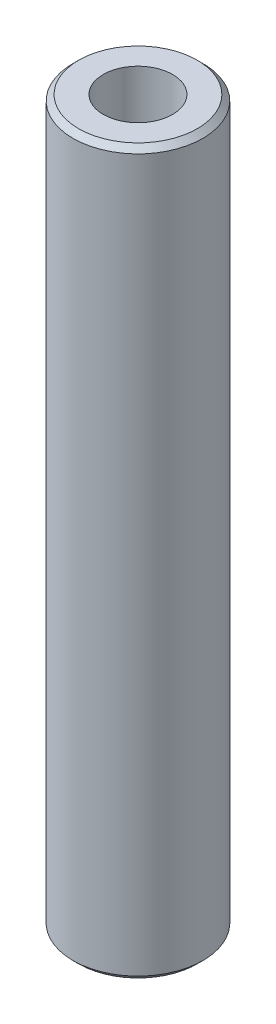
from build123d import *

# Parameters (mm, degrees)
SKETCH1_R           = 42.5
BOSS_EXTRUDE1_DEPTH = 473.387259306
SKETCH2_R           = 22.683361614
CUT_EXTRUDE1_DEPTH  = 478.187591281
CHAMFER1_SIZE       = 3.658712747


with BuildPart() as part:
    # Sketch1 → Boss-Extrude1 (new body)
    with BuildSketch(Plane(origin=(0, 0, 0), x_dir=(1, 0, 0), z_dir=(0, 1, 0))):
        Circle(SKETCH1_R)
    extrude(amount=BOSS_EXTRUDE1_DEPTH)

    # Sketch2 → Cut-Extrude1 (cut, through all)
    with BuildSketch(Plane(origin=(0, 0, 0), x_dir=(1, 0, 0), z_dir=(0, 1, 0))):
        Circle(SKETCH2_R)
    extrude(amount=CUT_EXTRUDE1_DEPTH, mode=Mode.SUBTRACT)

    # Chamfer1
    chamfer1_edges = [part.edges().sort_by_distance(p)[0] for p in [
        (-42.5, 473.387259306, 0),
        (-42.5, 0, 0),
    ]]
    chamfer(chamfer1_edges, length=CHAMFER1_SIZE)


solid = part.part
